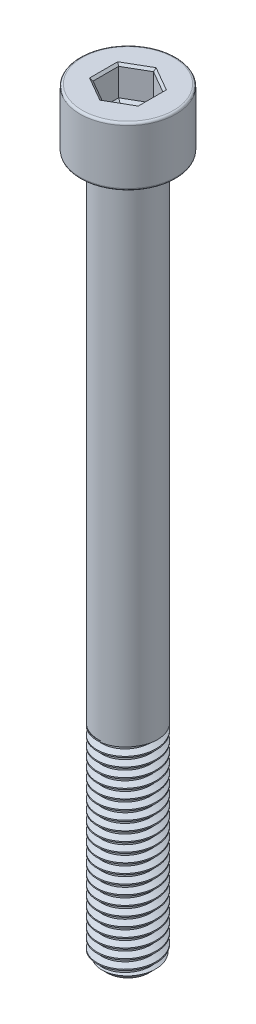
from build123d import *

# Parameters (mm, degrees)
SKETCH1_R           = 4
BOSS_EXTRUDE1_DEPTH = 28
THREAD1_PITCH       = 1.25
SKETCH2_R           = 4
BOSS_EXTRUDE2_DEPTH = 67
SKETCH5_R           = 6.5
BOSS_EXTRUDE3_DEPTH = 8
FILLET1_R           = 0.3
CUT_EXTRUDE1_DEPTH  = 4
CHAMFER1_SIZE       = 0.3
CUT_EXTRUDE2_DEPTH  = 0.4
CUT_EXTRUDE2_DRAFT  = -60


with BuildPart() as part:
    # Sketch1 → Boss-Extrude1 (new body)
    with BuildSketch(Plane(origin=(0, 0, 0), x_dir=(1, 0, 0), z_dir=(0, 1, 0))):
        with Locations(Location((0, 0, 0), (0, 0, 270))):
            Circle(SKETCH1_R)
    extrude(amount=BOSS_EXTRUDE1_DEPTH)

    # Thread1: the profile of Thread Profile1 profile screwed along a right-hand helix of 24 turns, 8 arcs to a turn; built about Z, then put on its axis
    thread1_z = Axis((0, 0, 0), (0, 0, 1))
    thread1_corners = [(4.0003, 0, -0.000173205), (4.0003, 0, 1.093923202), (3.323417656, 0, 0.703124998), (3.323417656, 0, 0.390624998)]
    with BuildLine(mode=Mode.PRIVATE) as thread1_profile:
        Line(thread1_corners[0], thread1_corners[1])
        Line(thread1_corners[1], thread1_corners[2])
        Line(thread1_corners[2], thread1_corners[3])
        Line(thread1_corners[3], thread1_corners[0])
    thread1_cap = Face(thread1_profile.wire())
    thread1_turn_angles = [0, 22.5, 45, 67.5, 90, 112.5, 135, 157.5, 180, 202.5, 225, 247.5, 270, 292.5, 315, 337.5, 360]
    thread1_turn_weights = [1, 0.9238795325112867, 1, 0.9238795325112867, 1, 0.9238795325112867, 1, 0.9238795325112867, 1, 0.9238795325112867, 1, 0.9238795325112867, 1, 0.9238795325112867, 1, 0.9238795325112867, 1]
    thread1_turn_rails = [Edge.make_bspline([Vector(p[0], p[1], 0).rotate(thread1_z, thread1_turn_angles[k]) / thread1_turn_weights[k] + Vector(0, 0, p[2] + THREAD1_PITCH * thread1_turn_angles[k] / 360) for k in range(17)], [0, 0, 0, 1, 1, 2, 2, 3, 3, 4, 4, 5, 5, 6, 6, 7, 7, 8, 8, 8], 2, thread1_turn_weights) for p in thread1_corners]
    thread1_turn_sides = [Face.make_surface_from_curves(thread1_turn_rails[p[0]], thread1_turn_rails[p[1]]) for p in [(0, 1), (1, 2), (2, 3), (3, 0)]]
    thread1 = Plane(origin=(0, 30, 0), x_dir=(-1, 0, 0), z_dir=(0, -1, 0)) * Solid(Shell([*[p.moved(Location((0, 0, THREAD1_PITCH * i))) for i in range(24) for p in thread1_turn_sides], thread1_cap, thread1_cap.rotate(thread1_z, 8640).moved(Location((0, 0, THREAD1_PITCH * 8640 / 360)))]))
    add(thread1, mode=Mode.SUBTRACT)

    # Sketch2 → Boss-Extrude2 (add)
    with BuildSketch(Plane(origin=(0, 28, 0), x_dir=(1, 0, 0), z_dir=(0, 1, 0))):
        with Locations(Location((0, 0, 0), (0, 0, 117.593571361))):
            Circle(SKETCH2_R)
    extrude(amount=BOSS_EXTRUDE2_DEPTH)

    # Sketch5 → Boss-Extrude3 (add)
    with BuildSketch(Plane(origin=(0, 95, 0), x_dir=(1, 0, 0), z_dir=(0, 1, 0))):
        with Locations(Location((0, 0, 0), (0, 0, 270))):
            Circle(SKETCH5_R)
    extrude(amount=BOSS_EXTRUDE3_DEPTH)

    # Sketch6 → Cut-Revolve1 (revolve, cut)
    with BuildSketch(Plane.XY, mode=Mode.PRIVATE) as cut_revolve1_sk:
        Polygon((4.01, 0), (4.01, 1.2), (2.81, 0), align=None)
    revolve(cut_revolve1_sk.sketch.rotate(Axis((0, 0, 0), (0, 1, 0)), 117.593571361), axis=Axis((0, 0, 0), (0, 1, 0)), mode=Mode.SUBTRACT)

    # Fillet1
    fillet1_edges = [part.edges().sort_by_distance(p)[0] for p in [
        (0, 95, -6.5),
        (0, 103, -6.5),
    ]]
    fillet(fillet1_edges, radius=FILLET1_R)

    # Sketch7 → Cut-Extrude1 (cut)
    with BuildSketch(Plane(origin=(0, 103, 0), x_dir=(1, 0, 0), z_dir=(0, 1, 0))):
        Polygon((0, 3.464101615), (-3, 1.732050808), (-3, -1.732050808), (0, -3.464101615), (3, -1.732050808), (3, 1.732050808), align=None)
    extrude(amount=-CUT_EXTRUDE1_DEPTH, mode=Mode.SUBTRACT)

    # Chamfer1
    chamfer1_edges = [part.edges().sort_by_distance(p)[0] for p in [
        (1.5, 103, -2.598076211),
        (-1.5, 103, -2.598076211),
        (-3, 103, 0),
        (-1.5, 103, 2.598076211),
        (1.5, 103, 2.598076211),
        (3, 103, 0),
    ]]
    chamfer(chamfer1_edges, length=CHAMFER1_SIZE)


with BuildPart() as cut_extrude2_tool:
    # Sketch8 → Cut-Extrude2 (with draft: the straight prism first)
    with BuildSketch(Plane(origin=(0, 99, 0), x_dir=(1, 0, 0), z_dir=(0, 1, 0))):
        Polygon((0, 3.464101615), (-3, 1.732050808), (-3, -1.732050808), (0, -3.464101615), (3, -1.732050808), (3, 1.732050808), align=None)
    extrude(amount=-CUT_EXTRUDE2_DEPTH)
    # Cut-Extrude2: the draft: its side faces are tilted about the plane it starts from
    cut_extrude2_sides = [cut_extrude2_tool.faces().sort_by_distance(p)[0] for p in [
        (-1.5, 98.8, -2.598076211),
        (-3, 98.8, 0),
        (-1.5, 98.8, 2.598076211),
        (1.5, 98.8, 2.598076211),
        (3, 98.8, 0),
        (1.5, 98.8, -2.598076211),
    ]]
    draft(cut_extrude2_sides, Plane(origin=(0, 99, 0), x_dir=(1, 0, 0), z_dir=(0, 1, 0)), CUT_EXTRUDE2_DRAFT)


with BuildPart() as part_1:
    add(part.part)

    # Cut-Extrude2: cut by cut_extrude2_tool
    add(cut_extrude2_tool.part, mode=Mode.SUBTRACT)


solid = part_1.part
